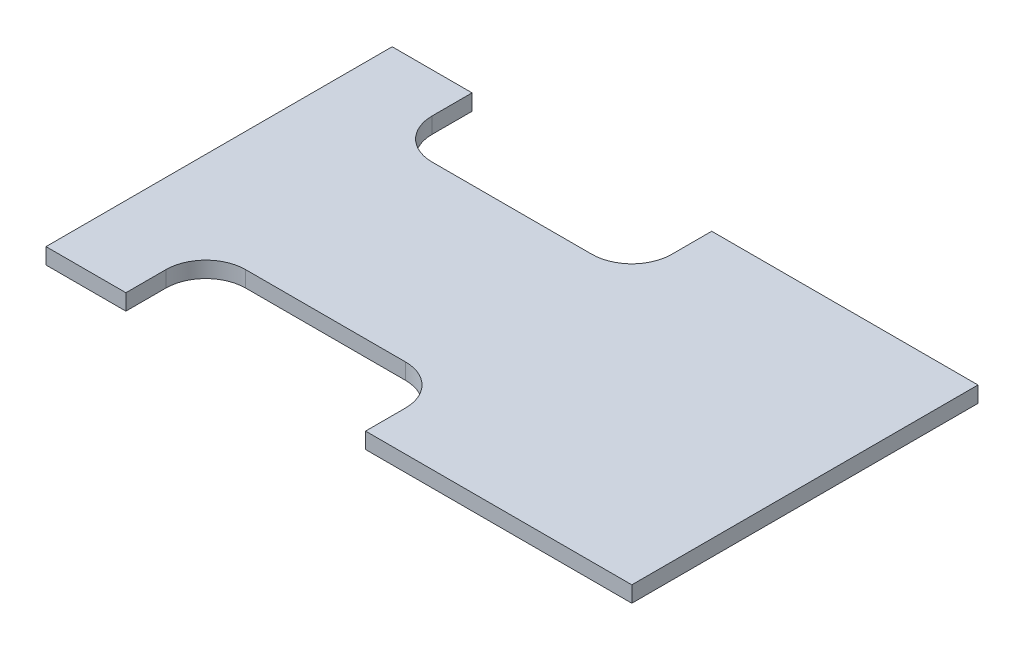
from build123d import *

# Parameters (mm, degrees)
SKETCH1_W           = 220
SKETCH1_H           = 130
BOSS_EXTRUDE1_DEPTH = 6
SKETCH2_W           = 90
SKETCH2_H           = 30
CUT_EXTRUDE1_DEPTH  = 128.910124697
FILLET1_R           = 15


with BuildPart() as part:
    # Sketch1 → Boss-Extrude1 (new body)
    with BuildSketch(Plane(origin=(0, 0, 0), x_dir=(1, 0, 0), z_dir=(0, 1, 0))):
        Rectangle(SKETCH1_W, SKETCH1_H)
    extrude(amount=BOSS_EXTRUDE1_DEPTH)

    # Sketch2 → Cut-Extrude1 (cut, through all)
    with BuildSketch(Plane(origin=(0, 6, 0), x_dir=(1, 0, 0), z_dir=(0, 1, 0))):
        with Locations((-35, -50)):
            Rectangle(SKETCH2_W, SKETCH2_H)
        with Locations((-35, 50)):
            Rectangle(SKETCH2_W, SKETCH2_H)
    extrude(amount=-CUT_EXTRUDE1_DEPTH, mode=Mode.SUBTRACT)

    # Fillet1
    fillet1_edges = [part.edges().sort_by_distance(p)[0] for p in [
        (10, 3, -35),
        (-80, 3, -35),
        (-80, 3, 35),
        (10, 3, 35),
    ]]
    fillet(fillet1_edges, radius=FILLET1_R)


solid = part.part
